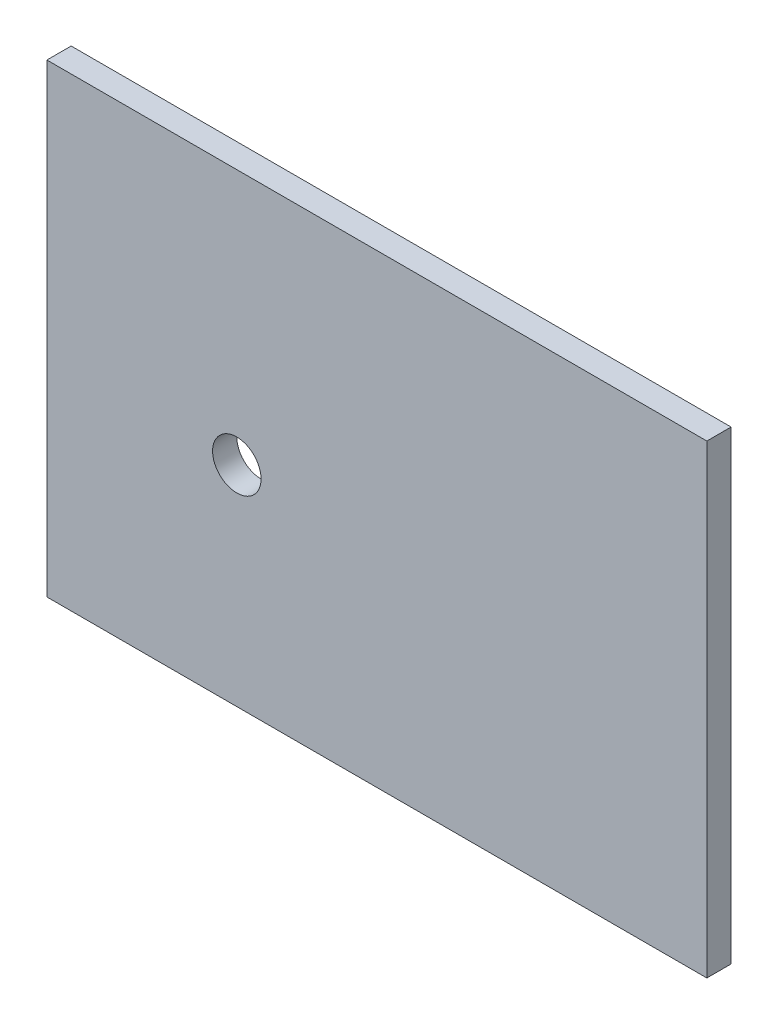
from build123d import *

# Parameters (mm, degrees)
ESBO_O1_W                = 108.863282572
ESBO_O1_H                = 76.71573604
ESBO_O1_R                = 4
RESSALTO_EXTRUS_O1_DEPTH = 4


with BuildPart() as part:
    # Esboço1 → Ressalto-extrusão1 (new body)
    with BuildSketch(Plane.XY):
        with Locations((23.10315218, 3.835786802)):
            Rectangle(ESBO_O1_W, ESBO_O1_H)
        Circle(ESBO_O1_R, mode=Mode.SUBTRACT)
    extrude(amount=RESSALTO_EXTRUS_O1_DEPTH)


solid = part.part
